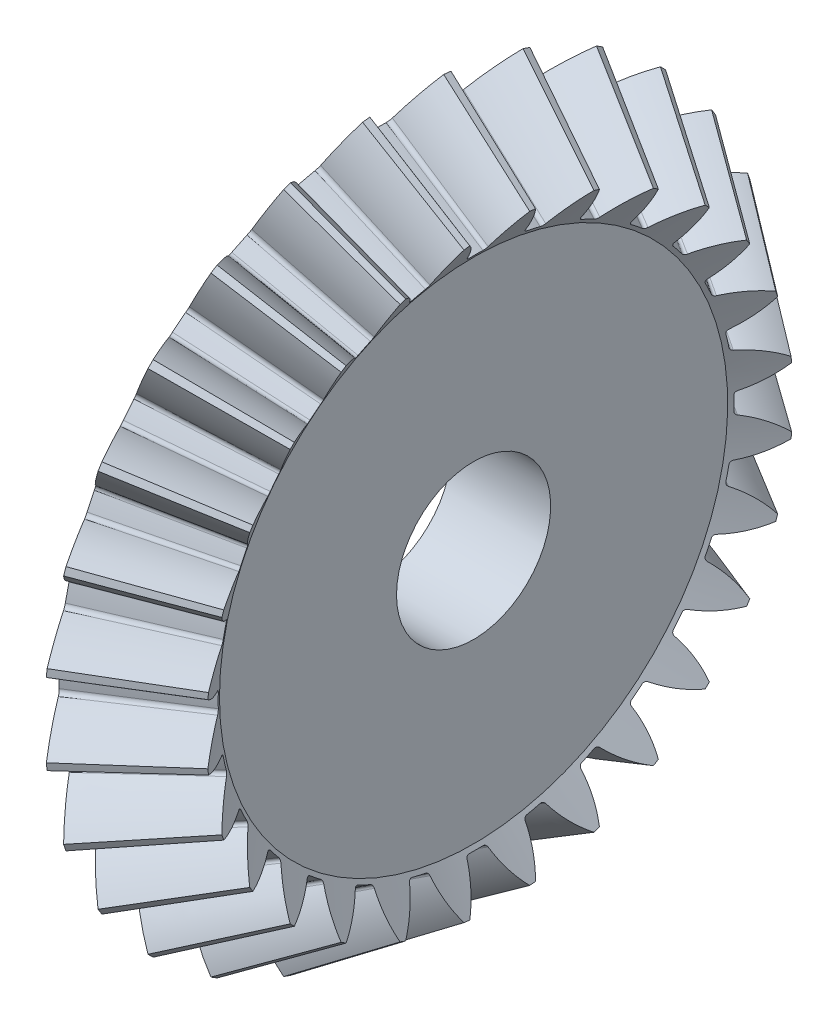
from build123d import *

# Parameters (mm, degrees)
TEETHCUTS_COUNT = 28
TEETHCUTS_ANGLE = 347.142857143
HUBSKE_R        = 4.5
HUB_DEPTH       = 0.0001016
BORSKE_R        = 4
BORE_DEPTH      = 27.058911544


with BuildPart() as part:
    # BasProSke → Base-Revolve (revolve)
    with BuildSketch(Plane(origin=(0, 0, 0), x_dir=(1, 0, 0), z_dir=(0, 1, 0)), mode=Mode.PRIVATE) as base_revolve_sk:
        Polygon((0, 0), (0, 16.286708884), (1.679431887, 18.805856711), (6.506165885, 15.229303882), (5.146133266, 13.189254956), (5.146133266, 0), align=None)
    revolve(base_revolve_sk.sketch.rotate(Axis((-10, 0, 0), (1, 0, 0)), 180), axis=Axis((-10, 0, 0), (1, 0, 0)))

    # ToothCut: read off the stored shape, not the designer's step
    # ToothCut: loft between two sections, ruled curve by curve
    toothcut_from = [
        Edge.make_bspline([(27.063493999, 0.006949881, -0.009566701), (27.060192051, 0.001996959, -0.01476401), (27.055833328, -0.004541127, -0.013926574), (27.053213137, -0.008471412, -0.007591451)], [0, 0, 0, 0, 1, 1, 1, 1], 3, [1, 0.786228818, 0.786228818, 1]),
        Edge.make_bspline([(27.053213137, -0.008471412, 0.007591451), (27.055833328, -0.004541127, 0.013926574), (27.060192051, 0.001996959, 0.01476401), (27.063493999, 0.006949881, 0.009566701)], [0, 0, 0, 0, 1, 1, 1, 1], 3, [1, 0.786228818, 0.786228818, 1]),
        Edge.make_bspline([(27.053213137, -0.008471412, -0.007591451), (27.052855987, -0.009007137, -0.00672793), (27.052562319, -0.009447639, -0.005789876), (27.052336856, -0.009785834, -0.00479237)], [0, 0, 0, 0, 1, 1, 1, 1], 3, [1, 0.994641063, 0.994641063, 1]),
        Edge.make_bspline([(27.052336856, -0.009785834, 0.00479237), (27.052562319, -0.009447639, 0.005789876), (27.052855987, -0.009007137, 0.00672793), (27.053213137, -0.008471412, 0.007591451)], [0, 0, 0, 0, 1, 1, 1, 1], 3, [1, 0.994641063, 0.994641063, 1]),
        Edge.make_bspline([(27.052336856, -0.009785834, -0.00479237), (27.051633436, -0.010840964, -0.001680272), (27.051633436, -0.010840964, 0.001680272), (27.052336856, -0.009785834, 0.00479237)], [0, 0, 0, 0, 1, 1, 1, 1], 3, [1, 0.95071327, 0.95071327, 1]),
        Edge.make_line((27.063493999, 0.006949881, 0.009566701), (27.063493999, 0.006949881, -0.009566701)),
    ]
    toothcut_to = [
        Edge.make_bspline([(1.821677566, 19.019225229, -2.201186514), (1.370213837, 18.342029636, -1.476485328), (0.838580937, 17.544580288, -0.957788713), (0.255126804, 16.669399089, -0.672754814)], [0, 0, 0, 0, 1, 1, 1, 1], 3, [1, 0.98222587, 0.98222587, 1]),
        Edge.make_bspline([(0.255126804, 16.669399089, 0.672754814), (0.838580937, 17.544580288, 0.957788713), (1.370213837, 18.342029636, 1.476485328), (1.821677566, 19.019225229, 2.201186514)], [0, 0, 0, 0, 1, 1, 1, 1], 3, [1, 0.98222587, 0.98222587, 1]),
        Edge.make_bspline([(0.255126804, 16.669399089, -0.672754814), (0.194381875, 16.578281695, -0.643079192), (0.156814405, 16.521930492, -0.552050649), (0.158504538, 16.52446569, -0.438632464)], [0, 0, 0, 0, 1, 1, 1, 1], 3, [1, 0.857322118, 0.857322118, 1]),
        Edge.make_bspline([(0.158504538, 16.52446569, 0.438632464), (0.156814405, 16.521930492, 0.552050649), (0.194381875, 16.578281695, 0.643079192), (0.255126804, 16.669399089, 0.672754814)], [0, 0, 0, 0, 1, 1, 1, 1], 3, [1, 0.857322118, 0.857322118, 1]),
        Edge.make_bspline([(0.158504538, 16.52446569, -0.438632464), (0.162861615, 16.531001306, -0.146245984), (0.162861615, 16.531001306, 0.146245984), (0.158504538, 16.52446569, 0.438632464)], [0, 0, 0, 0, 1, 1, 1, 1], 3, [1, 0.999759562, 0.999759562, 1]),
        Edge.make_line((1.821677566, 19.019225229, 2.201186514), (1.821677566, 19.019225229, -2.201186514)),
    ]
    toothcut = Solid(Shell([*[Face.make_surface_from_curves(toothcut_from[k], toothcut_to[k]) for k in range(6)], Face(Wire(toothcut_from)), Face(Wire(toothcut_to))]))
    add(toothcut, mode=Mode.SUBTRACT)

    # TeethCuts: ToothCut ×28 about axis
    teethcuts_axis = Axis((-10, 0, 0), (1, 0, 0))
    for i in range(1, TEETHCUTS_COUNT):
        add(toothcut.rotate(teethcuts_axis, i * TEETHCUTS_ANGLE / (TEETHCUTS_COUNT - 1)), mode=Mode.SUBTRACT)

    # HubSke → Hub (add)
    with BuildSketch(Plane.ZY):
        with Locations(Location((0, 0, 0), (0, 0, 180))):
            Circle(HUBSKE_R)
    extrude(amount=HUB_DEPTH)

    # BorSke → Bore (cut, symmetric)
    with BuildSketch(Plane(origin=(0, 0, 0), x_dir=(0, 0, -1), z_dir=(1, 0, 0))):
        with Locations(Location((0, 0, 0), (0, 0, 180))):
            Circle(BORSKE_R)
    extrude(amount=BORE_DEPTH, both=True, mode=Mode.SUBTRACT)


solid = part.part
